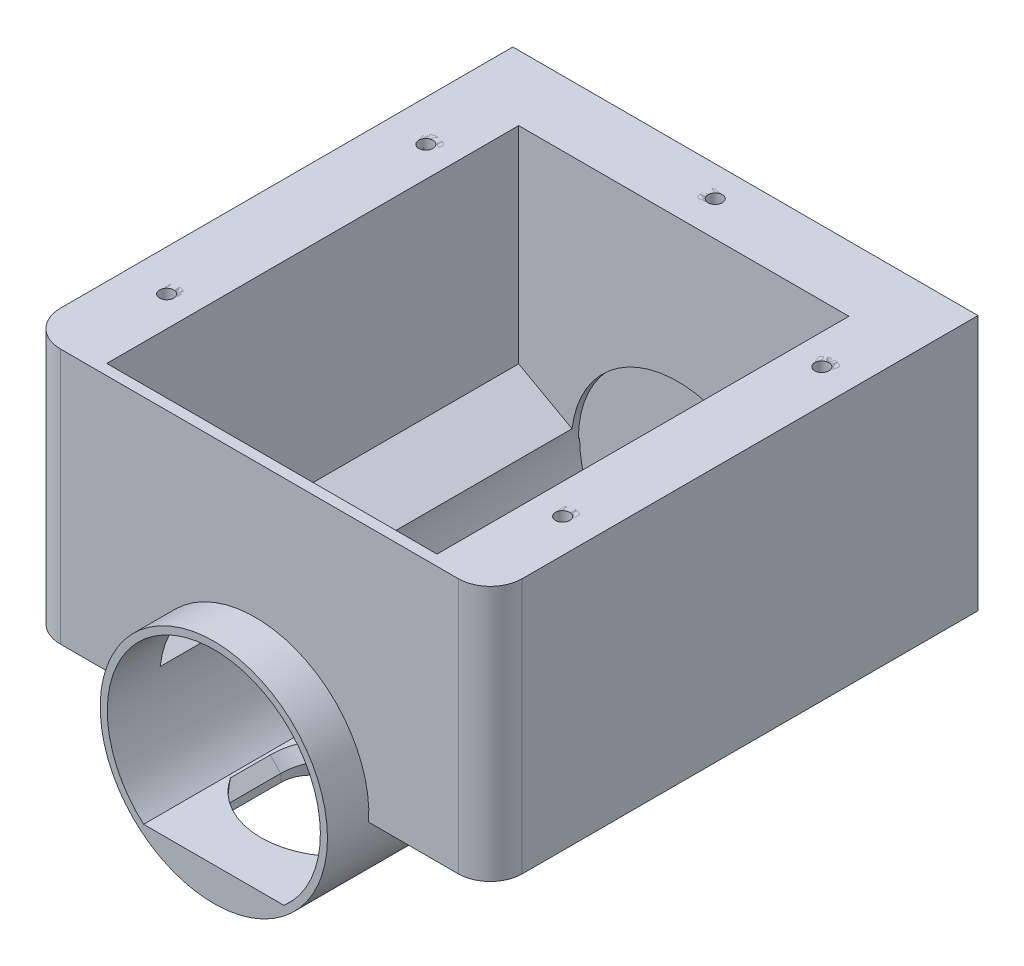
from build123d import *
from build123d.topology import SkipClean

# Parameters (mm, degrees)
SKETCH1_R                = 32
SKETCH1_R_2              = 30
BOSS_EXTRUDE1_DEPTH      = 60
BOSS_EXTRUDE3_START      = 120
BOSS_EXTRUDE3_DEPTH      = 120
BOSS_EXTRUDE4_START      = 3
SKETCH4_R                = 32
BOSS_EXTRUDE4_DEPTH      = 3
CUT_EXTRUDE2_DEPTH       = 3
SKETCH6_W                = 63.995066004
SKETCH6_H                = 2
SKETCH6_H_2              = 1.661946758
BOSS_EXTRUDE11_DEPTH     = 2
SKETCH6_8_W              = 63.995066004
SKETCH6_8_H              = 2
SKETCH6_8_H_2            = 1.661946758
BOSS_EXTRUDE12_DEPTH     = 70
BOSS_EXTRUDE14_DEPTH     = 120
CUT_EXTRUDE3_START       = -180
SKETCH10_R               = 30
CUT_EXTRUDE3_DEPTH       = 180
BOSS_EXTRUDE16_START     = -71
BOSS_EXTRUDE16_DEPTH     = 71
CUT_EXTRUDE6_START       = -69
CUT_EXTRUDE6_DEPTH       = 69
BOSS_EXTRUDE17_START     = 3.35
BOSS_EXTRUDE17_DEPTH     = 3.35
CUT_EXTRUDE11_START      = -71
CUT_EXTRUDE11_DEPTH      = 2
SKETCH16_W               = 37
SKETCH16_H               = 64
CUT_EXTRUDE15_DEPTH      = 94
CUT_EXTRUDE16_DEPTH      = 34
BOSS_EXTRUDE20_DEPTH     = 72
BOSS_EXTRUDE21_DEPTH     = 3
CUT_EXTRUDE17_START      = 34
SKETCH21_R               = 32
CUT_EXTRUDE17_DEPTH      = 34
SKETCH22_W               = 15
SKETCH22_H               = 13
SKETCH22_R               = 1.5
SKETCH22_W_2             = 15.435922779
BOSS_EXTRUDE23_DEPTH     = 10
CUT_EXTRUDE19_DEPTH      = 20
CUT_EXTRUDE19_DEPTH_BACK = 17
SKETCH22_2_R             = 1.5
BOSS_EXTRUDE24_START     = -145
BOSS_EXTRUDE24_DEPTH     = 145
SKETCH25_R               = 1.2
CUT_EXTRUDE21_DEPTH      = 82
CUT_EXTRUDE22_DEPTH      = 36
BOSS_EXTRUDE34_DEPTH     = 1
SKETCH30_W               = 137.35
SKETCH30_H               = 72
BOSS_EXTRUDE35_DEPTH     = 5
BOSS_EXTRUDE38_DEPTH     = 3
SKETCH34_R               = 1.5
CUT_EXTRUDE24_DEPTH      = 5
BOSS_EXTRUDE45_START     = 9
BOSS_EXTRUDE45_DEPTH     = 9
CUT_EXTRUDE30_DEPTH      = 9
CUT_EXTRUDE31_START      = -10
SKETCH37_R               = 32
CUT_EXTRUDE31_DEPTH      = 10
SKETCH38_R               = 3.5
BOSS_EXTRUDE64_DEPTH     = 11
BOSS_EXTRUDE64_2_DEPTH   = 11
BOSS_EXTRUDE64_3_DEPTH   = 11
BOSS_EXTRUDE64_4_DEPTH   = 11
BOSS_EXTRUDE64_5_DEPTH   = 11
SKETCH38_8_R             = 2
CUT_EXTRUDE33_DEPTH      = 9
CHAMFER1_SIZE            = 3
FILLET1_R                = 10
FILLET2_R                = 9


# Read off the part's stored shape, not the designer's step: Cut-Extrude11
with BuildPart() as part:
    # Sketch1 → Boss-Extrude1 (new body)
    with BuildSketch(Plane.XY):
        Circle(SKETCH1_R)
        Circle(SKETCH1_R_2, mode=Mode.SUBTRACT)
    extrude(amount=BOSS_EXTRUDE1_DEPTH)

    # Sketch3 → Boss-Extrude3 (add)
    with BuildSketch(Plane(origin=(0, 0, 0), x_dir=(-1, 0, 0), z_dir=(0, 0, -1)).offset(BOSS_EXTRUDE3_START)):
        with BuildLine():
            Line((-32, 0), (-30, 0))
            ThreePointArc((-30, 0), (0, -30), (30, 0))
            Line((30, 0), (32, 0))
            ThreePointArc((32, 0), (0, -32), (-32, 0))
        make_face()
    extrude(amount=-BOSS_EXTRUDE3_DEPTH)

    # Sketch4 → Boss-Extrude4 (add)
    with SkipClean():  # the faces are left unmerged after this step: merging them gives an invalid solid
        with BuildSketch(Plane(origin=(0, 0, -120), x_dir=(-1, 0, 0), z_dir=(0, 0, -1)).offset(BOSS_EXTRUDE4_START)):
            Circle(SKETCH4_R)
        extrude(amount=-BOSS_EXTRUDE4_DEPTH)

    # Sketch5 → Cut-Extrude2 (cut)
    with SkipClean():  # the faces are left unmerged after this step: merging them gives an invalid solid
        with BuildSketch(Plane(origin=(0, 0, -123), x_dir=(-1, 0, 0), z_dir=(0, 0, -1))):
            with BuildLine():
                Line((-1.05, 9.55), (1.05, 9.55))
                Line((1.05, 9.55), (1.05, 8.434897747))
                ThreePointArc((1.05, 8.434897747), (8.5, 0), (1.05, -8.434897747))
                Line((1.05, -8.434897747), (1.05, -9.55))
                Line((1.05, -9.55), (-1.05, -9.55))
                Line((-1.05, -9.55), (-1.05, -8.434897747))
                ThreePointArc((-1.05, -8.434897747), (-8.5, 0), (-1.05, 8.434897747))
                Line((-1.05, 8.434897747), (-1.05, 9.55))
            make_face()
        extrude(amount=-CUT_EXTRUDE2_DEPTH, mode=Mode.SUBTRACT)

    # Sketch6 → Boss-Extrude11 (add)
    with SkipClean():  # the faces are left unmerged after this step: merging them gives an invalid solid
        with BuildSketch(Plane(origin=(0, 0, 0), x_dir=(1, 0, 0), z_dir=(0, 1, 0))):
            Polygon((31.995066004, 0), (-32, 0), (-32, 1.661946758), (-44.809543956, 1.661946758), (-44.809543956, 117.661946758), (-32, 117.661946758), (-32, 119.661946758), (-46.809543956, 119.661946758), (-46.809543956, -0.338053242), (53.190456044, -0.338053242), (53.190456044, 119.661946758), (31.995066004, 119.661946758), (31.995066004, 117.661946758), (51.190456044, 117.661946758), (51.190456044, 1.661946758), (31.995066004, 1.661946758), align=None)
            with Locations((-0.002466998, 118.661946758)):
                Rectangle(SKETCH6_W, SKETCH6_H)
            with Locations((-0.002466998, 0.830973379)):
                Rectangle(SKETCH6_W, SKETCH6_H_2)
        extrude(amount=-BOSS_EXTRUDE11_DEPTH)

    # Sketch6<8> → Boss-Extrude12 (add)
    with SkipClean():  # the faces are left unmerged after this step: merging them gives an invalid solid
        with BuildSketch(Plane(origin=(0, 0, 0), x_dir=(1, 0, 0), z_dir=(0, 1, 0))):
            with Locations((-0.002466998, 118.661946758)):
                Rectangle(SKETCH6_8_W, SKETCH6_8_H)
            Polygon((31.995066004, 0), (-32, 0), (-32, 1.661946758), (-44.809543956, 1.661946758), (-44.809543956, 117.661946758), (-32, 117.661946758), (-32, 119.661946758), (-46.809543956, 119.661946758), (-46.809543956, -0.338053242), (53.190456044, -0.338053242), (53.190456044, 119.661946758), (31.995066004, 119.661946758), (31.995066004, 117.661946758), (51.190456044, 117.661946758), (51.190456044, 1.661946758), (31.995066004, 1.661946758), align=None)
            with Locations((-0.002466998, 0.830973379)):
                Rectangle(SKETCH6_8_W, SKETCH6_8_H_2)
        extrude(amount=BOSS_EXTRUDE12_DEPTH)

    # Sketch8 → Boss-Extrude14 (add)
    with BuildSketch(Plane(origin=(0, 0, -119.661946758), x_dir=(-1, 0, 0), z_dir=(0, 0, -1))):
        Polygon((46.809543956, 13), (19.679543956, -2), (46.809543956, -2), align=None)
        Polygon((-53.190456044, -2), (-26.064544809, -2), (-53.190456044, 14), align=None)
    extrude(amount=-BOSS_EXTRUDE14_DEPTH)

    # Sketch10 → Cut-Extrude3 (cut)
    with BuildSketch(Plane.XY.offset(60).offset(CUT_EXTRUDE3_START)):
        Circle(SKETCH10_R)
    extrude(amount=CUT_EXTRUDE3_DEPTH, mode=Mode.SUBTRACT)

    # Sketch12<4> → Boss-Extrude16 (add)
    with BuildSketch(Plane.XY.offset(60).offset(BOSS_EXTRUDE16_START)):
        with BuildLine():
            ThreePointArc((-10.994606962, -30.051932013), (0, -37.894244713), (10.994606962, -30.051932013))
            ThreePointArc((10.994606962, -30.051932013), (0, -32), (-10.994606962, -30.051932013))
        make_face()
    extrude(amount=BOSS_EXTRUDE16_DEPTH)

    # Sketch12<5> → Cut-Extrude6 (cut)
    with BuildSketch(Plane.XY.offset(60).offset(CUT_EXTRUDE6_START)):
        with BuildLine():
            ThreePointArc((-10.994606962, -30.051932013), (0, -37.894244713), (10.994606962, -30.051932013))
            ThreePointArc((10.994606962, -30.051932013), (0, -32), (-10.994606962, -30.051932013))
        make_face()
    extrude(amount=CUT_EXTRUDE6_DEPTH, mode=Mode.SUBTRACT)

    # Sketch13 → Boss-Extrude17 (add)
    with BuildSketch(Plane(origin=(0, 0, -119.661946758), x_dir=(-1, 0, 0), z_dir=(0, 0, -1)).offset(BOSS_EXTRUDE17_START)):
        with BuildLine():
            Line((31.937438845, -2), (46.809543956, -2))
            Line((46.809543956, -2), (46.809543956, 70))
            Line((46.809543956, 70), (-53.190456044, 70))
            Line((-53.190456044, 70), (-53.190456044, -2))
            Line((-53.190456044, -2), (-31.937438845, -2))
            ThreePointArc((-31.937438845, -2), (0, 32), (31.937438845, -2))
        make_face()
    extrude(amount=-BOSS_EXTRUDE17_DEPTH)

    # Cut-Extrude11 outline → Cut-Extrude11 (cut)
    with BuildSketch(Plane.XY.offset(60).offset(CUT_EXTRUDE11_START)):
        with BuildLine():
            ThreePointArc((10.994606962, -30.051932014), (0, -32), (-10.994606962, -30.051932014))
            ThreePointArc((-10.994606962, -30.051932014), (0, -37.894244713), (10.994606962, -30.051932014))
        make_face()
    extrude(amount=CUT_EXTRUDE11_DEPTH, mode=Mode.SUBTRACT)

    # Sketch16 → Cut-Extrude15 (cut)
    with BuildSketch(Plane.ZY.offset(46.809543956)):
        with Locations((41.5, 0)):
            Rectangle(SKETCH16_W, SKETCH16_H)
    extrude(amount=-CUT_EXTRUDE15_DEPTH, mode=Mode.SUBTRACT)

    # Sketch18 → Cut-Extrude16 (cut)
    with BuildSketch(Plane(origin=(0, -52, 0), x_dir=(-1, 0, 0), z_dir=(0, -1, 0))):
        with BuildLine():
            Line((-15.877168102, 6.841556737), (-15.877168102, 21.732917961))
            ThreePointArc((-15.877168102, 21.732917961), (0, 37.610086063), (15.877168102, 21.732917961))
            Line((15.877168102, 21.732917961), (15.877168102, 6.841556737))
            ThreePointArc((15.877168102, 6.841556737), (0, 0.265018377), (-15.877168102, 6.841556737))
        make_face()
    extrude(amount=-CUT_EXTRUDE16_DEPTH, mode=Mode.SUBTRACT)

    # Sketch19 → Boss-Extrude20 (add)
    with BuildSketch(Plane(origin=(0, 70, 0), x_dir=(1, 0, 0), z_dir=(0, 1, 0))):
        Polygon((-56.809543956, 2.661946758), (-56.809543956, 133.011946758), (63.190456044, 133.011946758), (63.190456044, 2.661946758), (53.190456044, 2.661946758), (53.190456044, -0.338053242), (63.190456044, -0.338053242), (66.190456044, -0.338053242), (66.190456044, 136.011946758), (-59.809543956, 136.011946758), (-59.809543956, -0.338053242), (-56.809543956, -0.338053242), (-46.809543956, -0.338053242), (-46.809543956, 2.661946758), align=None)
    extrude(amount=-BOSS_EXTRUDE20_DEPTH)

    # Sketch19<4> → Boss-Extrude21 (add)
    with BuildSketch(Plane(origin=(0, 70, 0), x_dir=(1, 0, 0), z_dir=(0, 1, 0))):
        Polygon((63.190456044, 133.011946758), (-56.809543956, 133.011946758), (-56.809543956, 2.661946758), (-46.809543956, 2.661946758), (-46.809543956, 123.011946758), (53.190456044, 123.011946758), (53.190456044, 2.661946758), (63.190456044, 2.661946758), align=None)
    extrude(amount=-BOSS_EXTRUDE21_DEPTH)

    # Sketch21 → Cut-Extrude17 (cut)
    with BuildSketch(Plane(origin=(0, 0, -123), x_dir=(-1, 0, 0), z_dir=(0, 0, -1)).offset(CUT_EXTRUDE17_START)):
        Circle(SKETCH21_R)
    extrude(amount=-CUT_EXTRUDE17_DEPTH, mode=Mode.SUBTRACT)

    # Sketch22 → Boss-Extrude23 (add)
    # profile 1 of 2: a face of its own
    with BuildSketch(Plane(origin=(0, 0, -136.011946758), x_dir=(-1, 0, 0), z_dir=(0, 0, -1))):
        with Locations((-58.690456044, 63.5)):
            Rectangle(SKETCH22_W, SKETCH22_H)
        with Locations((-58.690456044, 63.5)):
            Circle(SKETCH22_R, mode=Mode.SUBTRACT)
    # profile 2 of 2: a face of its own
    with BuildSketch(Plane(origin=(0, 0, -136.011946758), x_dir=(-1, 0, 0), z_dir=(0, 0, -1))):
        with Locations((52.091582567, 63.5)):
            Rectangle(SKETCH22_W_2, SKETCH22_H)
        with Locations((52.091582567, 63.5)):
            Circle(SKETCH22_R, mode=Mode.SUBTRACT)
    extrude(amount=-BOSS_EXTRUDE23_DEPTH)

    # Sketch22<2> → Cut-Extrude19 (cut, two sides: drawn at the far end of the back side and taken through both)
    with BuildSketch(Plane(origin=(0, 0, -136.011946758), x_dir=(-1, 0, 0), z_dir=(0, 0, -1)).offset(-CUT_EXTRUDE19_DEPTH_BACK)):
        with Locations((-58.690456044, 63.5)):
            Circle(SKETCH22_2_R)
        with Locations((52.091582567, 63.5)):
            Circle(SKETCH22_2_R)
    extrude(amount=CUT_EXTRUDE19_DEPTH + CUT_EXTRUDE19_DEPTH_BACK, mode=Mode.SUBTRACT)

    # Sketch23 → Boss-Extrude24 (add)
    with BuildSketch(Plane.XY.offset(23).offset(BOSS_EXTRUDE24_START)):
        with BuildLine():
            Line((-19.78090681, -22.554727349), (19.78090681, -22.554727349))
            ThreePointArc((19.78090681, -22.554727349), (0, -30), (-19.78090681, -22.554727349))
        make_face()
    extrude(amount=BOSS_EXTRUDE24_DEPTH)

    # Sketch25 → Cut-Extrude21 (cut)
    with BuildSketch(Plane.XY.offset(-37.610086063)):
        with Locations((19.78090681, -22.554727349)):
            Circle(SKETCH25_R)
        with Locations((-19.78090681, -22.554727349)):
            Circle(SKETCH25_R)
    extrude(amount=-CUT_EXTRUDE21_DEPTH, mode=Mode.SUBTRACT)

    # Sketch18<3> → Cut-Extrude22 (cut)
    with BuildSketch(Plane(origin=(0, -52, 0), x_dir=(-1, 0, 0), z_dir=(0, -1, 0))):
        with BuildLine():
            Line((-15.877168102, 6.841556737), (-15.877168102, 21.732917961))
            ThreePointArc((-15.877168102, 21.732917961), (0, 37.610086063), (15.877168102, 21.732917961))
            Line((15.877168102, 21.732917961), (15.877168102, 6.841556737))
            ThreePointArc((15.877168102, 6.841556737), (0, 0.265018377), (-15.877168102, 6.841556737))
        make_face()
    extrude(amount=-CUT_EXTRUDE22_DEPTH, mode=Mode.SUBTRACT)

    # Sketch29 → Boss-Extrude34 (add)
    with BuildSketch(Plane.XY.offset(0.338053242)):
        with BuildLine():
            Line((-59.809543956, -2), (-31.937438845, -2))
            ThreePointArc((-31.937438845, -2), (0, 32), (31.937438845, -2))
            Line((31.937438845, -2), (66.190456044, -2))
            Line((66.190456044, -2), (66.190456044, 70))
            Line((66.190456044, 70), (-59.809543956, 70))
            Line((-59.809543956, 70), (-59.809543956, -2))
        make_face()
    extrude(amount=BOSS_EXTRUDE34_DEPTH)

    # Sketch30 → Boss-Extrude35 (add)
    with BuildSketch(Plane.ZY.offset(59.809543956)):
        with Locations((-67.336946758, 34)):
            Rectangle(SKETCH30_W, SKETCH30_H)
    extrude(amount=BOSS_EXTRUDE35_DEPTH)

    # Sketch32 → Boss-Extrude38 (add)
    with BuildSketch(Plane.ZY.offset(-51.190456044)):
        Polygon((-117.661946758, 12.820316128), (-117.661946758, 9.981913466), (-1.661946758, 9.981913466), (-1.661946758, 12.820316128), (-1.661946758, 70), (-117.661946758, 70), align=None)
    extrude(amount=BOSS_EXTRUDE38_DEPTH)

    # Sketch34 → Cut-Extrude24 (cut)
    with BuildSketch(Plane.XZ.offset(2)):
        with Locations(Location((-40.059543956, -95.463258513, 0), (0, 0, 270))):
            Circle(SKETCH34_R)
        with Locations(Location((-40.059543956, -29.463258513, 0), (0, 0, 270))):
            Circle(SKETCH34_R)
        with Locations(Location((41.440456044, -29.463258513, 0), (0, 0, 270))):
            Circle(SKETCH34_R)
        with Locations(Location((41.440456044, -95.463258513, 0), (0, 0, 270))):
            Circle(SKETCH34_R)
    extrude(amount=-CUT_EXTRUDE24_DEPTH, mode=Mode.SUBTRACT)

    # Sketch35 → Boss-Extrude45 (add)
    with BuildSketch(Plane(origin=(0, 0, -123), x_dir=(-1, 0, 0), z_dir=(0, 0, -1)).offset(BOSS_EXTRUDE45_START)):
        with BuildLine():
            Line((-29.933259094, -2), (-31.937438845, -2))
            ThreePointArc((-31.937438845, -2), (0, -32), (31.937438845, -2))
            Line((31.937438845, -2), (29.933259094, -2))
            ThreePointArc((29.933259094, -2), (0, -30), (-29.933259094, -2))
        make_face()
        with BuildLine():
            ThreePointArc((31.937438845, -2), (0, 32), (-31.937438845, -2))
            Line((-31.937438845, -2), (-29.933259094, -2))
            ThreePointArc((-29.933259094, -2), (-1.000556639, 29.983310131), (30, 0))
            ThreePointArc((30, 0), (29.983310131, -1.000556639), (29.933259094, -2))
            Line((29.933259094, -2), (31.937438845, -2))
        make_face()
    extrude(amount=-BOSS_EXTRUDE45_DEPTH)

    # Sketch36 → Cut-Extrude30 (cut)
    with BuildSketch(Plane(origin=(0, 0, -132), x_dir=(-1, 0, 0), z_dir=(0, 0, -1))):
        with BuildLine():
            Line((31.205638995, -7.085767068), (29.151190457, -7.085767068))
            ThreePointArc((29.151190457, -7.085767068), (0, 30), (-29.151190457, -7.085767068))
            Line((-29.151190457, -7.085767068), (-31.205638995, -7.085767068))
            ThreePointArc((-31.205638995, -7.085767068), (0, 32), (31.205638995, -7.085767068))
        make_face()
    extrude(amount=-CUT_EXTRUDE30_DEPTH, mode=Mode.SUBTRACT)

    # Sketch37 → Cut-Extrude31 (cut)
    with BuildSketch(Plane.XY.offset(23).offset(CUT_EXTRUDE31_START)):
        with Locations(Location((0, 0, 0), (0, 0, 183.583321698))):
            Circle(SKETCH37_R)
    extrude(amount=CUT_EXTRUDE31_DEPTH, mode=Mode.SUBTRACT)


with BuildPart() as body_2:
    # Sketch38 → Boss-Extrude64 (new body)
    with BuildSketch(Plane(origin=(0, 70, 0), x_dir=(1, 0, 0), z_dir=(0, 1, 0))):
        with Locations(Location((0.690456044, 127.511946758, 0), (0, 0, 270))):
            Circle(SKETCH38_R)
    extrude(amount=-BOSS_EXTRUDE64_DEPTH)


with BuildPart() as body_3:
    # Sketch38 → Boss-Extrude64 2 (new body)
    with BuildSketch(Plane(origin=(0, 70, 0), x_dir=(1, 0, 0), z_dir=(0, 1, 0))):
        with Locations(Location((56.690456044, 101.5250616, 0), (0, 0, 270))):
            Circle(SKETCH38_R)
    extrude(amount=-BOSS_EXTRUDE64_2_DEPTH)


with BuildPart() as body_4:
    # Sketch38 → Boss-Extrude64 3 (new body)
    with BuildSketch(Plane(origin=(0, 70, 0), x_dir=(1, 0, 0), z_dir=(0, 1, 0))):
        with Locations(Location((56.690456044, 28.5250616, 0), (0, 0, 270))):
            Circle(SKETCH38_R)
    extrude(amount=-BOSS_EXTRUDE64_3_DEPTH)


with BuildPart() as body_5:
    # Sketch38 → Boss-Extrude64 4 (new body)
    with BuildSketch(Plane(origin=(0, 70, 0), x_dir=(1, 0, 0), z_dir=(0, 1, 0))):
        with Locations(Location((-53.312713224, 100.011946758, 0), (0, 0, 270))):
            Circle(SKETCH38_R)
    extrude(amount=-BOSS_EXTRUDE64_4_DEPTH)


with BuildPart() as body_6:
    # Sketch38 → Boss-Extrude64 5 (new body)
    with BuildSketch(Plane(origin=(0, 70, 0), x_dir=(1, 0, 0), z_dir=(0, 1, 0))):
        with Locations(Location((-53.312713224, 27.011946758, 0), (0, 0, 270))):
            Circle(SKETCH38_R)
    extrude(amount=-BOSS_EXTRUDE64_5_DEPTH)


with BuildPart() as cut_extrude33_tool:
    # Sketch38<8> → Cut-Extrude33 (new body)
    with BuildSketch(Plane(origin=(0, 70, 0), x_dir=(1, 0, 0), z_dir=(0, 1, 0))):
        with Locations(Location((0.690456044, 127.511946758, 0), (0, 0, 270))):
            Circle(SKETCH38_8_R)
        with Locations(Location((56.690456044, 101.5250616, 0), (0, 0, 270))):
            Circle(SKETCH38_8_R)
        with Locations(Location((56.690456044, 28.5250616, 0), (0, 0, 270))):
            Circle(SKETCH38_8_R)
        with Locations(Location((-53.312713224, 100.011946758, 0), (0, 0, 270))):
            Circle(SKETCH38_8_R)
        with Locations(Location((-53.312713224, 27.011946758, 0), (0, 0, 270))):
            Circle(SKETCH38_8_R)
    extrude(amount=-CUT_EXTRUDE33_DEPTH)


with BuildPart() as part_1:
    add(part.part)

    # Cut-Extrude33: cut by cut_extrude33_tool
    add(cut_extrude33_tool.part, mode=Mode.SUBTRACT)

    # Chamfer1
    # the kernel refuses this chamfer: 3 mm, written as the material it takes off along each edge
    with BuildSketch(Plane(origin=(0, -22.554727349, -21.732917961), x_dir=(-1, 0, 0), z_dir=(0, 0, 1))) as chamfer1_piece_1:
        Polygon((15.877168102 + CHAMFER1_SIZE, 0), (15.877168102, CHAMFER1_SIZE), (15.877168102, 0), align=None)
    revolve(axis=Axis((0, -22.554727349, -21.732917961), (0, -1, 0)), revolution_arc=180, mode=Mode.SUBTRACT)
    with BuildSketch(Plane(origin=(-15.877168102, -22.554727349, 0.873492227), x_dir=(-0.9996219169112965, 0.02749587661058676, 0), z_dir=(0, 0, -1))) as chamfer1_piece_2_section:
        Polygon((CHAMFER1_SIZE * 0.999621916911, -CHAMFER1_SIZE * 0.0274958766106), (-CHAMFER1_SIZE * 0.0274958766106, -CHAMFER1_SIZE * 0.999621916911), (0, 0), align=None)
    chamfer1_piece_2 = extrude(amount=22.606410188, mode=Mode.PRIVATE)
    chamfer1_piece_2 = chamfer1_piece_2 & Plane(origin=(0, -23.57021251, -22.718724839), x_dir=(-0.7071067811865468, 0, 0.7071067811865482), z_dir=(0, -1, 0)) * Cylinder(22.453706462, 58, mode=Mode.PRIVATE)
    add(chamfer1_piece_2, mode=Mode.SUBTRACT)
    with BuildSketch(Plane(origin=(15.877168102, -22.554727349, -21.732917961), x_dir=(0.9996219169112965, 0.02749587661058676, 0), z_dir=(0, 0, 1))) as chamfer1_piece_3_section:
        Polygon((CHAMFER1_SIZE * 0.999621916911, -CHAMFER1_SIZE * 0.0274958766106), (-CHAMFER1_SIZE * 0.0274958766106, -CHAMFER1_SIZE * 0.999621916911), (0, 0), align=None)
    chamfer1_piece_3 = extrude(amount=22.606410188, mode=Mode.PRIVATE)
    chamfer1_piece_3 = chamfer1_piece_3 & Plane(origin=(0, -23.570212508, -22.718724839), x_dir=(-0.7071067811865468, 0, 0.7071067811865482), z_dir=(0, -1, 0)) * Cylinder(22.453706462, 58, mode=Mode.PRIVATE)
    add(chamfer1_piece_3, mode=Mode.SUBTRACT)

    # Fillet1
    # the kernel refuses this fillet: 10 mm, written as the material it takes off along each edge
    with BuildSketch(Plane(origin=(-64.809543956, 95, 1.338053242), x_dir=(1, 0, 0), z_dir=(0, -1, 0))) as fillet1_piece_1:
        with BuildLine():
            CenterArc((FILLET1_R, -FILLET1_R), FILLET1_R, 90, 90)
            Line((0, -FILLET1_R), (0, 0))
            Line((0, 0), (FILLET1_R, 0))
        make_face()
    extrude(amount=122, mode=Mode.SUBTRACT)

    # Fillet2
    # the kernel refuses this fillet: 9 mm, written as the material it takes off along each edge
    with BuildSketch(Plane(origin=(66.190456044, -24.5, 1.338053242), x_dir=(-1, 0, 0), z_dir=(0, 1, 0))) as fillet2_piece_1:
        with BuildLine():
            CenterArc((FILLET2_R, -FILLET2_R), FILLET2_R, 90, 90)
            Line((0, -FILLET2_R), (0, 0))
            Line((0, 0), (FILLET2_R, 0))
        make_face()
    extrude(amount=117, mode=Mode.SUBTRACT)


with BuildPart() as body_2_1:
    add(body_2.part)

    # Cut-Extrude33: cut by cut_extrude33_tool
    add(cut_extrude33_tool.part, mode=Mode.SUBTRACT)


with BuildPart() as body_3_1:
    add(body_3.part)

    # Cut-Extrude33: cut by cut_extrude33_tool
    add(cut_extrude33_tool.part, mode=Mode.SUBTRACT)


with BuildPart() as body_4_1:
    add(body_4.part)

    # Cut-Extrude33: cut by cut_extrude33_tool
    add(cut_extrude33_tool.part, mode=Mode.SUBTRACT)


with BuildPart() as body_5_1:
    add(body_5.part)

    # Cut-Extrude33: cut by cut_extrude33_tool
    add(cut_extrude33_tool.part, mode=Mode.SUBTRACT)


with BuildPart() as body_6_1:
    add(body_6.part)

    # Cut-Extrude33: cut by cut_extrude33_tool
    add(cut_extrude33_tool.part, mode=Mode.SUBTRACT)


solid = Compound([part_1.part, body_2_1.part, body_3_1.part, body_4_1.part, body_5_1.part, body_6_1.part])
